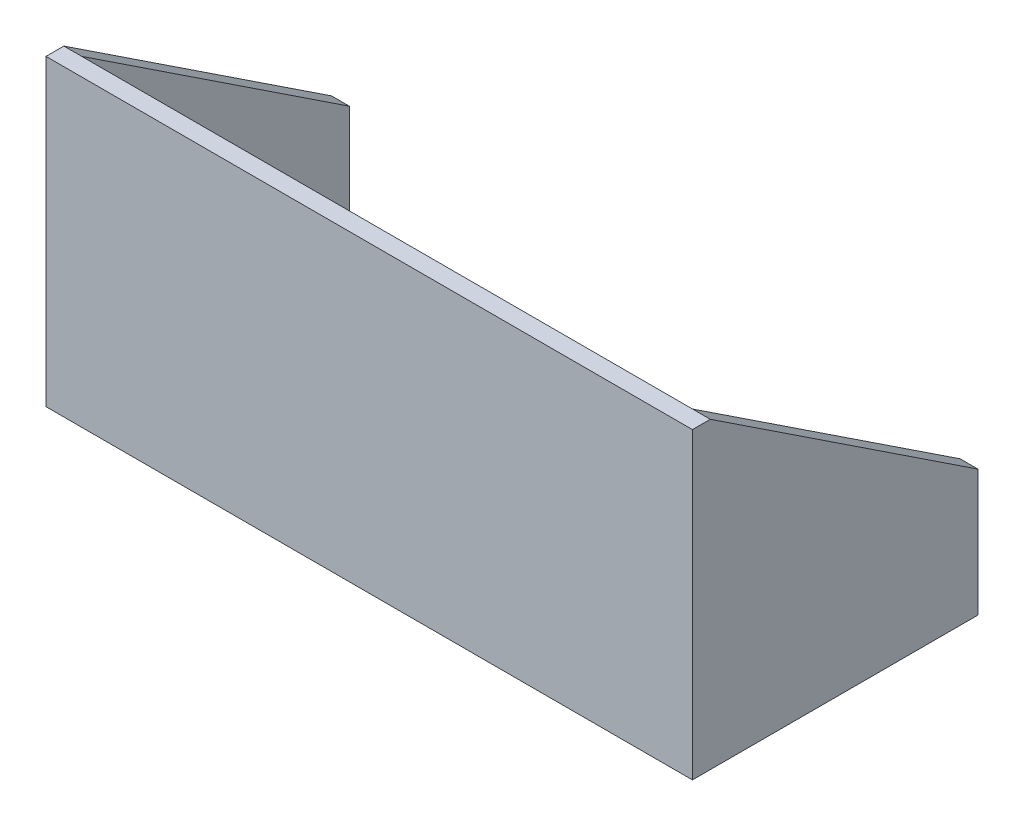
from build123d import *

# Parameters (mm, degrees)
BOSS_EXTRUDE1_DEPTH     = 115
SKETCH2_R               = 2.5
CUT_EXTRUDE1_DEPTH      = 171.92584101
CUT_EXTRUDE2_DEPTH      = 150.015569656
CUT_EXTRUDE2_DEPTH_BACK = 150.015569656
SKETCH4_R               = 3.3
SPLIT1_SURFACE_1_BACK   = 266.855
SPLIT1_SURFACE_1_DEPTH  = 533.71
SPLIT1_SURFACE_2_BACK   = 266.855
SPLIT1_SURFACE_2_DEPTH  = 533.71
SKETCH6_W               = 6.35
SKETCH6_H               = 21.6
BOSS_EXTRUDE2_DEPTH     = 230
DELETEFACE1_START       = -3.175
DELETEFACE1_OUTLINE_R   = 3.3
DELETEFACE1_DEPTH       = 6.35
DELETEFACE1_START_2     = 44.45
DELETEFACE1_2_OUTLINE_R = 2.5
DELETEFACE1_2_DEPTH     = 6.35
BOSS_EXTRUDE3_DEPTH     = 6.35


# Read off the part's stored shape, not the designer's step: DeleteFace1
with BuildPart() as part:
    # Sketch1 → Boss-Extrude1 (new, symmetric)
    with BuildSketch(Plane(origin=(0, 0, 0), x_dir=(0, 0, -1), z_dir=(1, 0, 0))):
        Polygon((-50.8, -3.175), (50.8, -3.175), (50.8, 3.175), (-44.45, 3.175), (-44.45, 83.175), (-50.8, 83.175), (-50.8, 3.175), align=None)
    extrude(amount=BOSS_EXTRUDE1_DEPTH, both=True)

    # Sketch2 → Cut-Extrude1 (cut, through all)
    with BuildSketch(Plane(origin=(0, 0, 44.45), x_dir=(-1, 0, 0), z_dir=(0, 0, -1))):
        with Locations(Location((-32.5, 73.491666667, 0), (0, 0, 90))):
            Circle(SKETCH2_R)
        with Locations(Location((-32.5, 11.825, 0), (0, 0, 90))):
            Circle(SKETCH2_R)
        with Locations(Location((32.5, 11.825, 0), (0, 0, 90))):
            Circle(SKETCH2_R)
        with Locations(Location((32.5, 73.491666667, 0), (0, 0, 90))):
            Circle(SKETCH2_R)
        with Locations(Location((-102.75, 73.491666667, 0), (0, 0, 90))):
            Circle(SKETCH2_R)
        with Locations(Location((-102.75, 11.825, 0), (0, 0, 90))):
            Circle(SKETCH2_R)
        with Locations(Location((102.75, 73.491666667, 0), (0, 0, 90))):
            Circle(SKETCH2_R)
        with Locations(Location((102.75, 11.825, 0), (0, 0, 90))):
            Circle(SKETCH2_R)
    extrude(amount=-CUT_EXTRUDE1_DEPTH, mode=Mode.SUBTRACT)

    # Sketch4 → Cut-Extrude2 (cut, two sides: drawn at the far end of the back side and taken through both)
    with BuildSketch(Plane(origin=(0, 3.175, 0), x_dir=(1, 0, 0), z_dir=(0, 1, 0)).offset(-CUT_EXTRUDE2_DEPTH_BACK)):
        with Locations(Location((56.37, 25.8, 0), (0, 0, 270))):
            Circle(SKETCH4_R)
        with Locations(Location((96.37, 25.8, 0), (0, 0, 270))):
            Circle(SKETCH4_R)
        with Locations(Location((96.37, -27.2, 0), (0, 0, 270))):
            Circle(SKETCH4_R)
        with Locations(Location((56.37, -27.2, 0), (0, 0, 270))):
            Circle(SKETCH4_R)
        with Locations(Location((-96.37, 25.8, 0), (0, 0, 90))):
            Circle(SKETCH4_R)
        with Locations(Location((-96.37, -27.2, 0), (0, 0, 90))):
            Circle(SKETCH4_R)
        with Locations(Location((-56.37, -27.2, 0), (0, 0, 90))):
            Circle(SKETCH4_R)
        with Locations(Location((-56.37, 25.8, 0), (0, 0, 90))):
            Circle(SKETCH4_R)
    extrude(amount=CUT_EXTRUDE2_DEPTH + CUT_EXTRUDE2_DEPTH_BACK, mode=Mode.SUBTRACT)


with BuildPart() as body_2:
    # Split1: the piece behind the surface
    add(part.part)
    # Split1 surface: a surface, the sketch's curves swept straight by 533.71 mm
    with BuildLine(Plane.ZY.offset(115).offset(-SPLIT1_SURFACE_1_BACK), mode=Mode.PRIVATE) as split1_surface_1_path:
        Line((44.45, 3.175), (50.8, 3.175))
    split1_surface_1 = Shell.extrude(split1_surface_1_path.wire(), (-1 * SPLIT1_SURFACE_1_DEPTH, 0 * SPLIT1_SURFACE_1_DEPTH, 0 * SPLIT1_SURFACE_1_DEPTH))
    split(bisect_by=split1_surface_1, keep=Keep.BOTTOM)


with BuildPart() as part_1:
    add(part.part)

    # Split1: split by a surface, the side it looks to stays
    # Split1 surface: a surface, the sketch's curves swept straight by 533.71 mm
    with BuildLine(Plane.ZY.offset(115).offset(-SPLIT1_SURFACE_2_BACK), mode=Mode.PRIVATE) as split1_surface_2_path:
        Line((44.45, 3.175), (50.8, 3.175))
    split1_surface_2 = Shell.extrude(split1_surface_2_path.wire(), (-1 * SPLIT1_SURFACE_2_DEPTH, 0 * SPLIT1_SURFACE_2_DEPTH, 0 * SPLIT1_SURFACE_2_DEPTH))
    split(bisect_by=split1_surface_2, keep=Keep.TOP)

    # Sketch6 → Boss-Extrude2 (add)
    with BuildSketch(Plane.ZY.offset(115)):
        with Locations((47.625, 93.975)):
            Rectangle(SKETCH6_W, SKETCH6_H)
    extrude(amount=-BOSS_EXTRUDE2_DEPTH)


with BuildPart() as body_2_1:
    add(body_2.part)

    # Combine1: union part
    add(part_1.part)

    # DeleteFace1 outline → DeleteFace1 (add)
    with BuildSketch(Plane(origin=(0, 0, 0), x_dir=(1, 0, 0), z_dir=(0, 1, 0)).offset(DELETEFACE1_START)):
        with Locations((56.37, 25.8)):
            Circle(DELETEFACE1_OUTLINE_R)
        with Locations((-56.37, 25.8)):
            Circle(DELETEFACE1_OUTLINE_R)
        with Locations((-56.37, -27.2)):
            Circle(DELETEFACE1_OUTLINE_R)
        with Locations((-96.37, -27.2)):
            Circle(DELETEFACE1_OUTLINE_R)
        with Locations((-96.37, 25.8)):
            Circle(DELETEFACE1_OUTLINE_R)
        with Locations((56.37, -27.2)):
            Circle(DELETEFACE1_OUTLINE_R)
        with Locations((96.37, -27.2)):
            Circle(DELETEFACE1_OUTLINE_R)
        with Locations((96.37, 25.8)):
            Circle(DELETEFACE1_OUTLINE_R)
    extrude(amount=DELETEFACE1_DEPTH)

    # DeleteFace1 2 outline → DeleteFace1 2 (add)
    with BuildSketch(Plane.XY.offset(DELETEFACE1_START_2)):
        with Locations((32.5, 11.825)):
            Circle(DELETEFACE1_2_OUTLINE_R)
        with Locations((-32.5, 11.825)):
            Circle(DELETEFACE1_2_OUTLINE_R)
        with Locations((-32.5, 73.491666667)):
            Circle(DELETEFACE1_2_OUTLINE_R)
        with Locations((102.75, 73.491666667)):
            Circle(DELETEFACE1_2_OUTLINE_R)
        with Locations((-102.75, 11.825)):
            Circle(DELETEFACE1_2_OUTLINE_R)
        with Locations((-102.75, 73.491666667)):
            Circle(DELETEFACE1_2_OUTLINE_R)
        with Locations((102.75, 11.825)):
            Circle(DELETEFACE1_2_OUTLINE_R)
        with Locations((32.5, 73.491666667)):
            Circle(DELETEFACE1_2_OUTLINE_R)
    extrude(amount=DELETEFACE1_2_DEPTH)

    # Sketch10 → Boss-Extrude3 (add)
    with BuildSketch(Plane.ZY.offset(115)):
        Polygon((44.45, 104.775), (-50.8, 41.802895791), (-50.8, 3.175), (44.45, 3.175), align=None)
    boss_extrude3 = extrude(amount=-BOSS_EXTRUDE3_DEPTH)

    # Mirror1: Boss-Extrude3 across plane
    add(boss_extrude3.mirror(Plane(origin=(0, 0, 0), x_dir=(0, 0, 1), z_dir=(1, 0, 0))))


solid = body_2_1.part
